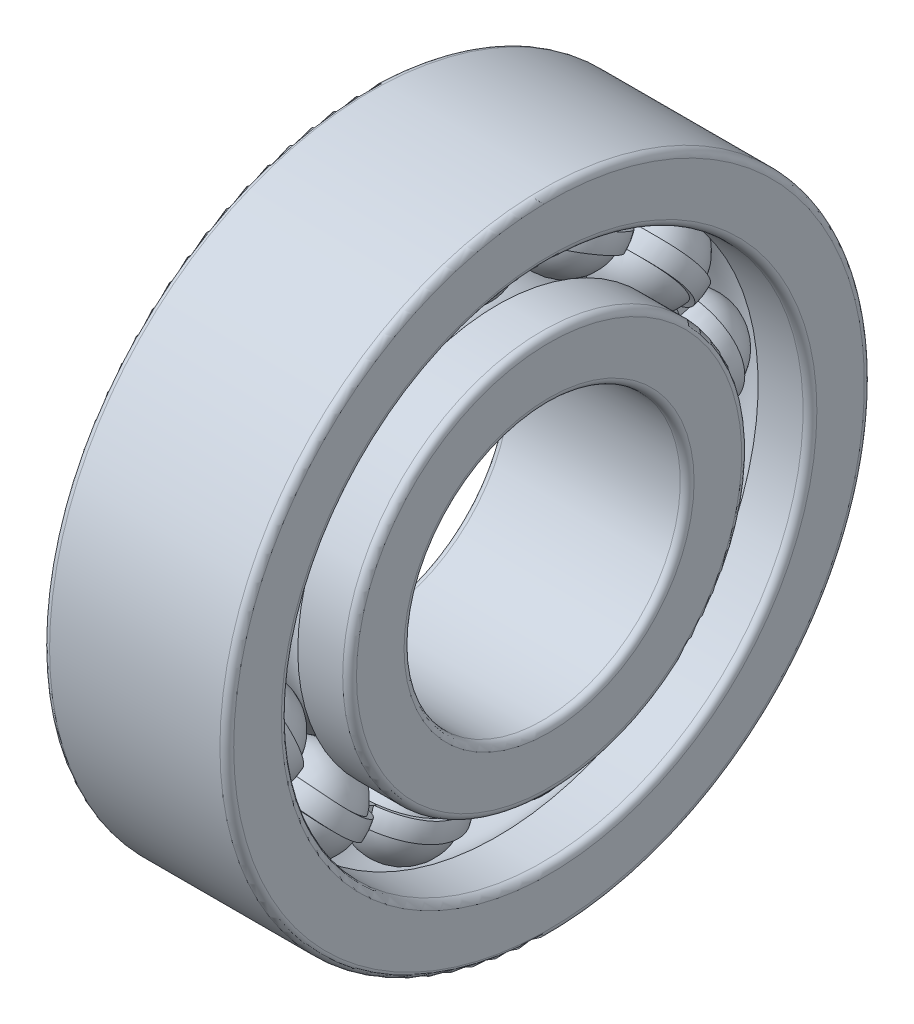
from build123d import *

# Parameters (mm, degrees)
SKETCH_5_W               = 1.2
SKETCH_5_H               = 0.8
PATTERN_CIRCULAR_5_COUNT = 13
PATTERN_CIRCULAR_2_COUNT = 13


with BuildPart() as part:
    # 草图2 → 旋转1 (revolve)
    with BuildSketch(Plane.XY):
        with BuildLine():
            Line((3.7, 6), (-3.7, 6))
            ThreePointArc((-3.7, 6), (-3.912132034, 6.087867966), (-4, 6.3))
            Line((-4, 6.3), (-4, 8.366666667))
            ThreePointArc((-4, 8.366666667), (-3.912132034, 8.578798701), (-3.7, 8.666666667))
            Line((-3.7, 8.666666667), (-1.490711985, 8.666666667))
            ThreePointArc((-1.490711985, 8.666666667), (0, 8), (1.490711985, 8.666666667))
            Line((1.490711985, 8.666666667), (3.7, 8.666666667))
            ThreePointArc((3.7, 8.666666667), (3.912132034, 8.578798701), (4, 8.366666667))
            Line((4, 8.366666667), (4, 6.3))
            ThreePointArc((4, 6.3), (3.912132034, 6.087867966), (3.7, 6))
        make_face()
        with BuildLine():
            Line((-4, 13.7), (-4, 11.633333333))
            ThreePointArc((-4, 11.633333333), (-3.912132034, 11.421201299), (-3.7, 11.333333333))
            Line((-3.7, 11.333333333), (-1.490711985, 11.333333333))
            ThreePointArc((-1.490711985, 11.333333333), (0, 12), (1.490711985, 11.333333333))
            Line((1.490711985, 11.333333333), (3.7, 11.333333333))
            ThreePointArc((3.7, 11.333333333), (3.912132034, 11.421201299), (4, 11.633333333))
            Line((4, 11.633333333), (4, 13.7))
            ThreePointArc((4, 13.7), (3.912132034, 13.912132034), (3.7, 14))
            Line((3.7, 14), (-3.7, 14))
            ThreePointArc((-3.7, 14), (-3.912132034, 13.912132034), (-4, 13.7))
        make_face()
    revolve(axis=Axis((-3.5, 0, 0), (1, 0, 0)))


with BuildPart() as body_2:
    # 草图5 → 旋转3 (revolve)
    with BuildSketch(Plane.XY):
        with Locations((0, 10)):
            Rectangle(SKETCH_5_W, SKETCH_5_H)
    revolve(axis=Axis((-19.927092192, 0, 0), (1, 0, 0)))



with BuildPart() as body_3:
    # 草图3 → 旋转2 (revolve)
    with BuildSketch(Plane.XY):
        with BuildLine():
            ThreePointArc((2.2, 10), (0, 12.2), (-2.2, 10))
            Line((-2.2, 10), (2.2, 10))
        make_face()
    revolve(axis=Axis((-2.2, 10, 0), (1, 0, 0)))


with BuildPart() as pattern_circular_5_1:
    # 阵列(圆周)5: pattern copy
    add(body_3.part.rotate(Axis((-3.85, 0, 0), (1, 0, 0)), 1 * 360 / PATTERN_CIRCULAR_5_COUNT))


with BuildPart() as pattern_circular_5_2:
    # 阵列(圆周)5: pattern copy
    add(body_3.part.rotate(Axis((-3.85, 0, 0), (1, 0, 0)), 2 * 360 / PATTERN_CIRCULAR_5_COUNT))


with BuildPart() as pattern_circular_5_3:
    # 阵列(圆周)5: pattern copy
    add(body_3.part.rotate(Axis((-3.85, 0, 0), (1, 0, 0)), 3 * 360 / PATTERN_CIRCULAR_5_COUNT))


with BuildPart() as pattern_circular_5_4:
    # 阵列(圆周)5: pattern copy
    add(body_3.part.rotate(Axis((-3.85, 0, 0), (1, 0, 0)), 4 * 360 / PATTERN_CIRCULAR_5_COUNT))


with BuildPart() as pattern_circular_5_5:
    # 阵列(圆周)5: pattern copy
    add(body_3.part.rotate(Axis((-3.85, 0, 0), (1, 0, 0)), 5 * 360 / PATTERN_CIRCULAR_5_COUNT))


with BuildPart() as pattern_circular_5_6:
    # 阵列(圆周)5: pattern copy
    add(body_3.part.rotate(Axis((-3.85, 0, 0), (1, 0, 0)), 6 * 360 / PATTERN_CIRCULAR_5_COUNT))


with BuildPart() as pattern_circular_5_7:
    # 阵列(圆周)5: pattern copy
    add(body_3.part.rotate(Axis((-3.85, 0, 0), (1, 0, 0)), 7 * 360 / PATTERN_CIRCULAR_5_COUNT))


with BuildPart() as pattern_circular_5_8:
    # 阵列(圆周)5: pattern copy
    add(body_3.part.rotate(Axis((-3.85, 0, 0), (1, 0, 0)), 8 * 360 / PATTERN_CIRCULAR_5_COUNT))


with BuildPart() as pattern_circular_5_9:
    # 阵列(圆周)5: pattern copy
    add(body_3.part.rotate(Axis((-3.85, 0, 0), (1, 0, 0)), 9 * 360 / PATTERN_CIRCULAR_5_COUNT))


with BuildPart() as pattern_circular_5_10:
    # 阵列(圆周)5: pattern copy
    add(body_3.part.rotate(Axis((-3.85, 0, 0), (1, 0, 0)), 10 * 360 / PATTERN_CIRCULAR_5_COUNT))


with BuildPart() as pattern_circular_5_11:
    # 阵列(圆周)5: pattern copy
    add(body_3.part.rotate(Axis((-3.85, 0, 0), (1, 0, 0)), 11 * 360 / PATTERN_CIRCULAR_5_COUNT))


with BuildPart() as pattern_circular_5_12:
    # 阵列(圆周)5: pattern copy
    add(body_3.part.rotate(Axis((-3.85, 0, 0), (1, 0, 0)), 12 * 360 / PATTERN_CIRCULAR_5_COUNT))


with BuildPart() as cut_revolve_1_tool:
    # 草图6 → 切除-旋转1 (revolve)
    with BuildSketch(Plane.XY):
        with BuildLine():
            Line((-2.163330765, 10.4), (2.163330765, 10.4))
            ThreePointArc((2.163330765, 10.4), (0, 12.2), (-2.163330765, 10.4))
        make_face()
        with BuildLine():
            Line((-2.163330765, 9.6), (2.163330765, 9.6))
            ThreePointArc((2.163330765, 9.6), (0, 7.8), (-2.163330765, 9.6))
        make_face()
    revolve(axis=Axis((-19.927092192, 0, 0), (1, 0, 0)))


with BuildPart() as part_1:
    add(part.part)

    # 切除-旋转1: cut by cut_revolve_1_tool
    add(cut_revolve_1_tool.part, mode=Mode.SUBTRACT)


with BuildPart() as body_3_1:
    add(body_3.part)

    # 切除-旋转1: cut by cut_revolve_1_tool
    add(cut_revolve_1_tool.part, mode=Mode.SUBTRACT)


with BuildPart() as pattern_circular_5_1_1:
    add(pattern_circular_5_1.part)

    # 切除-旋转1: cut by cut_revolve_1_tool
    add(cut_revolve_1_tool.part, mode=Mode.SUBTRACT)


with BuildPart() as pattern_circular_5_2_1:
    add(pattern_circular_5_2.part)

    # 切除-旋转1: cut by cut_revolve_1_tool
    add(cut_revolve_1_tool.part, mode=Mode.SUBTRACT)


with BuildPart() as pattern_circular_5_3_1:
    add(pattern_circular_5_3.part)

    # 切除-旋转1: cut by cut_revolve_1_tool
    add(cut_revolve_1_tool.part, mode=Mode.SUBTRACT)


with BuildPart() as pattern_circular_5_4_1:
    add(pattern_circular_5_4.part)

    # 切除-旋转1: cut by cut_revolve_1_tool
    add(cut_revolve_1_tool.part, mode=Mode.SUBTRACT)


with BuildPart() as pattern_circular_5_5_1:
    add(pattern_circular_5_5.part)

    # 切除-旋转1: cut by cut_revolve_1_tool
    add(cut_revolve_1_tool.part, mode=Mode.SUBTRACT)


with BuildPart() as pattern_circular_5_6_1:
    add(pattern_circular_5_6.part)

    # 切除-旋转1: cut by cut_revolve_1_tool
    add(cut_revolve_1_tool.part, mode=Mode.SUBTRACT)


with BuildPart() as pattern_circular_5_7_1:
    add(pattern_circular_5_7.part)

    # 切除-旋转1: cut by cut_revolve_1_tool
    add(cut_revolve_1_tool.part, mode=Mode.SUBTRACT)


with BuildPart() as pattern_circular_5_8_1:
    add(pattern_circular_5_8.part)

    # 切除-旋转1: cut by cut_revolve_1_tool
    add(cut_revolve_1_tool.part, mode=Mode.SUBTRACT)


with BuildPart() as pattern_circular_5_9_1:
    add(pattern_circular_5_9.part)

    # 切除-旋转1: cut by cut_revolve_1_tool
    add(cut_revolve_1_tool.part, mode=Mode.SUBTRACT)


with BuildPart() as pattern_circular_5_10_1:
    add(pattern_circular_5_10.part)

    # 切除-旋转1: cut by cut_revolve_1_tool
    add(cut_revolve_1_tool.part, mode=Mode.SUBTRACT)


with BuildPart() as pattern_circular_5_11_1:
    add(pattern_circular_5_11.part)

    # 切除-旋转1: cut by cut_revolve_1_tool
    add(cut_revolve_1_tool.part, mode=Mode.SUBTRACT)


with BuildPart() as pattern_circular_5_12_1:
    add(pattern_circular_5_12.part)

    # 切除-旋转1: cut by cut_revolve_1_tool
    add(cut_revolve_1_tool.part, mode=Mode.SUBTRACT)


with BuildPart() as body_2_1:
    add(body_2.part)

    add(body_3_1.part)  # 旋转4 merges body 3
    # 草图7 → 旋转4 (revolve)
    with BuildSketch(Plane.XY):
        with BuildLine():
            Line((-2, 10), (2, 10))
            ThreePointArc((2, 10), (0, 12), (-2, 10))
        make_face()
    revolve_4 = revolve(axis=Axis((-2, 10, 0), (1, 0, 0)))

    # 阵列(圆周)2: 旋转4 ×13 about axis
    pattern_circular_2_axis = Axis((-3.85, 0, 0), (1, 0, 0))
    for i in range(1, PATTERN_CIRCULAR_2_COUNT):
        add(revolve_4.rotate(pattern_circular_2_axis, i * 360 / PATTERN_CIRCULAR_2_COUNT))


solid = Compound([part_1.part, pattern_circular_5_1_1.part, pattern_circular_5_2_1.part, pattern_circular_5_3_1.part, pattern_circular_5_4_1.part, pattern_circular_5_5_1.part, pattern_circular_5_6_1.part, pattern_circular_5_7_1.part, pattern_circular_5_8_1.part, pattern_circular_5_9_1.part, pattern_circular_5_10_1.part, pattern_circular_5_11_1.part, pattern_circular_5_12_1.part, body_2_1.part])
